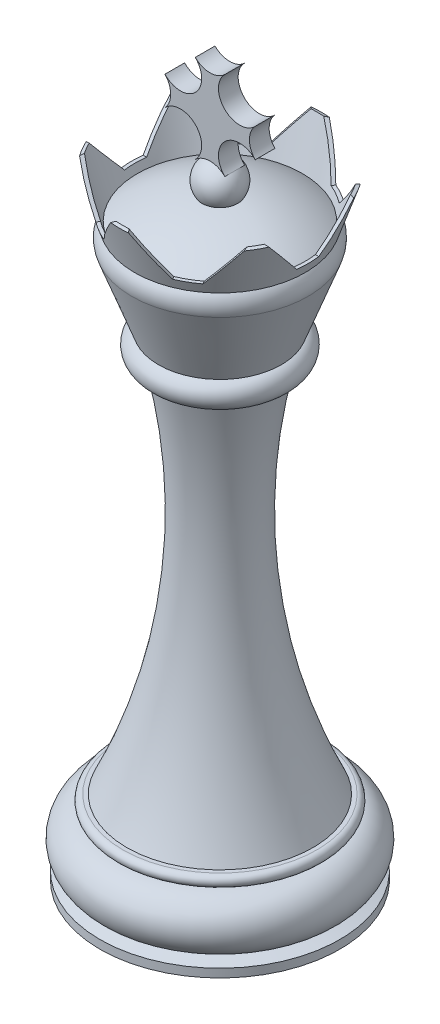
from build123d import *

# Parameters (mm, degrees)
CUT_EXTRUDE2_DEPTH  = 74.274296975
CIRPATTERN1_COUNT   = 6
BOSS_EXTRUDE2_DEPTH = 1.27
FILLET2_R           = 2.54


with BuildPart() as part:
    # Sketch1 → Revolve1 (revolve)
    with BuildSketch(Plane.XY, mode=Mode.PRIVATE) as revolve1_sk:
        with BuildLine():
            Line((0, 62.887005158), (0, -9.621899222))
            Line((0, -9.621899222), (15.450410298, -9.621899222))
            Line((15.450410298, -9.621899222), (15.450410298, -8.530075969))
            Line((15.450410298, -8.530075969), (13.893883706, -8.017710004))
            ThreePointArc((13.893883706, -8.017710004), (15.773602868, -4.193417719), (12.478125528, -1.49186544))
            Line((12.478125528, -1.49186544), (12.478125528, -1.42836544))
            ThreePointArc((12.478125528, -1.42836544), (13.215841354, -0.726095063), (12.5015625, 0))
            Line((12.5015625, 0), (11.997414701, 0))
            ThreePointArc((11.997414701, 0), (5.387821929, 23.819079982), (6.901087077, 48.49184465))
            ThreePointArc((6.901087077, 48.49184465), (8.979181431, 49.688094116), (7.911461263, 51.835060015))
            Line((7.911461263, 51.835060015), (11.99982135, 62.887005158))
            Line((11.99982135, 62.887005158), (0, 62.887005158))
        make_face()
        with BuildLine():
            ThreePointArc((10.634624536, 63.907165059), (10.814082096, 63.783742301), (10.992107389, 63.658262472))
            Line((10.992107389, 63.658262472), (12.978293629, 69.629001059))
            Line((12.978293629, 69.629001059), (12.581879041, 69.760869703))
            Line((12.581879041, 69.760869703), (10.634624536, 63.907165059))
        make_face()
    revolve(revolve1_sk.sketch.rotate(Axis((0, 0, 0), (0, -1, 0)), 90), axis=Axis((0, 0, 0), (0, -1, 0)))

    # Sketch8 → Cut-Extrude2 (cut, through all)
    with BuildSketch(Plane(origin=(0, 0, 0), x_dir=(0, 0, -1), z_dir=(1, 0, 0))):
        Polygon((-1.428771389, 64.897346506), (1.428771389, 64.897346506), (5.972518416, 70.239813687), (-5.972518416, 70.239813687), align=None)
    cut_extrude2 = extrude(amount=CUT_EXTRUDE2_DEPTH, mode=Mode.SUBTRACT)

    # CirPattern1: Cut-Extrude2 ×6 about axis
    cirpattern1_axis = Axis((0, 0, 0), (0, 1, 0))
    for i in range(1, CIRPATTERN1_COUNT):
        add(cut_extrude2.rotate(cirpattern1_axis, i * 360 / CIRPATTERN1_COUNT), mode=Mode.SUBTRACT)

    # Sketch1<10> one side → Revolve2 (revolve)
    with BuildSketch(Plane.XY, mode=Mode.PRIVATE) as revolve2_sk:
        with BuildLine():
            Line((0, 71.246759945), (0, 67.177658079))
            ThreePointArc((0, 67.177658079), (1.153728364, 67.142458775), (2.303165116, 67.036991796))
            ThreePointArc((2.303165116, 67.036991796), (2.399308099, 69.824506799), (0, 71.246759945))
        make_face()
        with BuildLine():
            Line((0, 65.776929635), (0, 62.887005158))
            Line((0, 62.887005158), (11.99982135, 62.887005158))
            ThreePointArc((11.99982135, 62.887005158), (7.44643893, 65.651154197), (2.303165116, 67.036991796))
            ThreePointArc((2.303165116, 67.036991796), (1.312662009, 66.112536691), (0, 65.776929635))
        make_face()
    revolve(revolve2_sk.sketch.rotate(Axis((0, 67.177658079, 0), (0, 1, 0)), 266.251805894), axis=Axis((0, 67.177658079, 0), (0, 1, 0)))

    # Fillet2
    # the kernel refuses this fillet: 2.54 mm, written as the material it takes off along each edge
    with BuildSketch(Plane(origin=(0, 62.887005158, 0), x_dir=(0, 0, 1), z_dir=(1, 0, 0))) as fillet2_piece_1:
        with BuildLine():
            CenterArc((8.995907198, 0.799342826), FILLET2_R, 321.804511732, 58.496042059)
            Line((10.992107389, -0.771257314), (11.032031393, -0.802669316))
            ThreePointArc((11.032031393, -0.802669316), (11.533305395, -0.434417916), (12.032031398, -0.039282984))
            Line((12.032031398, -0.039282984), (12.047465937, 0.017624792))
            Line((12.047465937, 0.017624792), (11.425781162, 1.698207198))
            Line((11.425781162, 1.698207198), (11.378136575, 1.680582406))
        make_face()
    revolve(axis=Axis((0, 62.887005158, 0), (0, -1, 0)), revolution_arc=3.748194106, mode=Mode.SUBTRACT)
    with BuildSketch(Plane(origin=(0, 62.887005158, 0), x_dir=(-0.06537167788558164, 0, 0.9978609841708531), z_dir=(0.9978609841708531, 0, 0.06537167788558164))) as fillet2_piece_2:
        with BuildLine():
            CenterArc((8.995907198, 0.799342826), FILLET2_R, 321.804511732, 58.496042059)
            Line((10.992107389, -0.771257314), (11.032031393, -0.802669316))
            ThreePointArc((11.032031393, -0.802669316), (11.533305395, -0.434417916), (12.032031398, -0.039282984))
            Line((12.032031398, -0.039282984), (12.047465937, 0.017624792))
            Line((12.047465937, 0.017624792), (11.425781162, 1.698207198))
            Line((11.425781162, 1.698207198), (11.378136575, 1.680582406))
        make_face()
    revolve(axis=Axis((0, 62.887005158, 0), (0, -1, 0)), revolution_arc=356.251805894, mode=Mode.SUBTRACT)


with BuildPart() as body_2:
    # Sketch1<11> → Boss-Extrude2 (new, symmetric)
    with BuildSketch(Plane.XY):
        with BuildLine():
            ThreePointArc((5.813889583, 78.036687482), (5.075519313, 76.167578222), (5.813889583, 74.298468961))
            ThreePointArc((5.813889583, 74.298468961), (1.902907105, 74.382482742), (1.908672349, 70.470602246))
            ThreePointArc((1.908672349, 70.470602246), (0, 71.246759945), (-1.908672349, 70.470602246))
            ThreePointArc((-1.908672349, 70.470602246), (-1.902907105, 74.382482742), (-5.813889583, 74.298468961))
            ThreePointArc((-5.813889583, 74.298468961), (-5.075519313, 76.167578222), (-5.813889583, 78.036687482))
            ThreePointArc((-5.813889583, 78.036687482), (-1.902907105, 77.952673702), (-1.908672349, 81.864554198))
            ThreePointArc((-1.908672349, 81.864554198), (0, 81.088396498), (1.908672349, 81.864554198))
            ThreePointArc((1.908672349, 81.864554198), (1.902907105, 77.952673702), (5.813889583, 78.036687482))
        make_face()
    extrude(amount=BOSS_EXTRUDE2_DEPTH, both=True)


solid = Compound([part.part, body_2.part])
